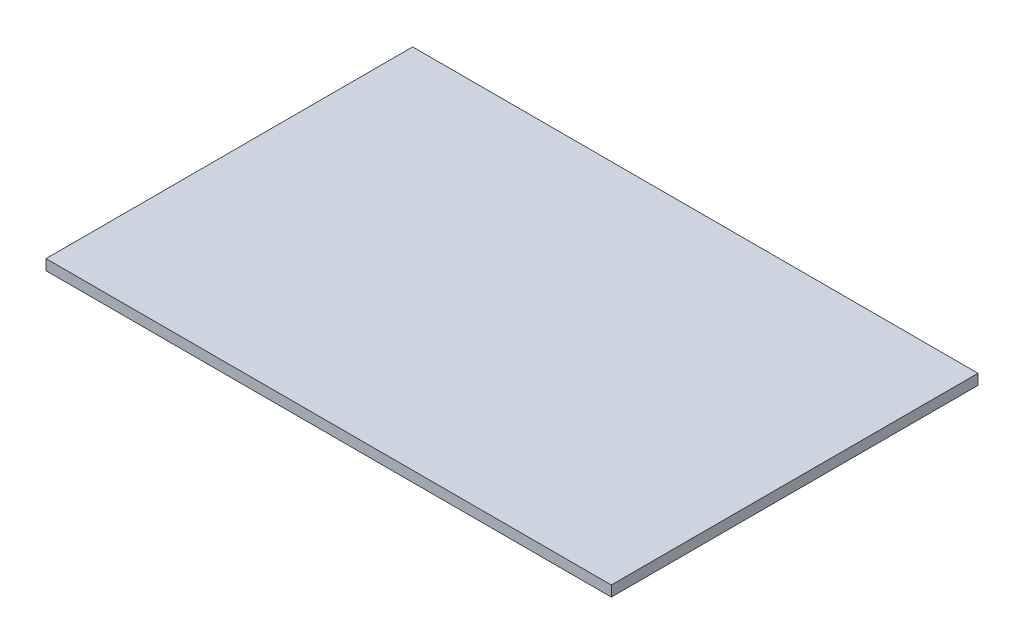
from build123d import *

# Parameters (mm, degrees)
SKETCH1_W           = 939.8
SKETCH1_H           = 609.6
BOSS_EXTRUDE1_DEPTH = 17.4752


with BuildPart() as part:
    # Sketch1 → Boss-Extrude1 (new body)
    with BuildSketch(Plane(origin=(0, 0, 0), x_dir=(1, 0, 0), z_dir=(0, 1, 0))):
        Rectangle(SKETCH1_W, SKETCH1_H)
    extrude(amount=BOSS_EXTRUDE1_DEPTH)


solid = part.part
